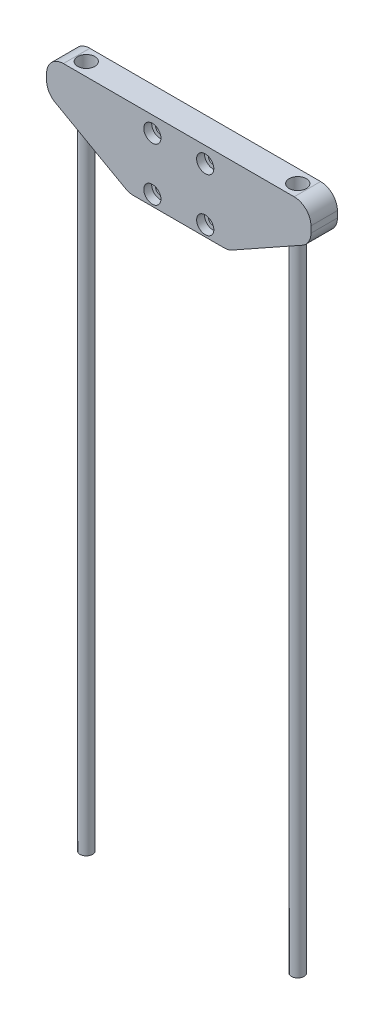
from build123d import *

# Parameters (mm, degrees)
BOSS_EXTRUDE1_DEPTH            = 5
CUT_EXTRUDE1_DEPTH             = 10
SKETCH4_W                      = 2.38125
SKETCH4_H                      = 243.6
SKETCH4_3_W                    = 2.38125
SKETCH4_3_H                    = 243.6
CBORE_FOR_M3_SHCS1_AT_2_COUNT  = 2
CBORE_FOR_M3_SHCS1_AT_2_PITCH  = 20
CBORE_FOR_M3_SHCS1_AT_3_COUNT  = 2
CBORE_FOR_M3_SHCS1_AT_3_PITCH  = 28.284271247
CBORE_FOR_M3_SHCS1_AT_4_COUNT  = 2
CBORE_FOR_M3_SHCS1_AT_4_PITCH  = 20
CBORE_FOR_M3_SHCS2_AT_2_COUNT  = 2
CBORE_FOR_M3_SHCS2_AT_2_PITCH  = 80
M3X0_5_TAPPED_HOLE1_AT_2_COUNT = 2
M3X0_5_TAPPED_HOLE1_AT_2_PITCH = 80
FILLET1_R                      = 6.35


with BuildPart() as part:
    # Sketch3 → Boss-Extrude1 (new, symmetric)
    with BuildSketch(Plane.XY):
        Polygon((-50, 15), (-50, 2.5), (-18.75, -15), (18.75, -15), (50, 2.5), (50, 15), align=None)
    extrude(amount=BOSS_EXTRUDE1_DEPTH, both=True)

    # Sketch10 → Cut-Extrude1 (cut)
    with BuildSketch(Plane(origin=(0, 0, 0), x_dir=(1, 0, 0), z_dir=(0, 1, 0))):
        with BuildLine():
            Line((40, 2.38125), (35, 2.38125))
            ThreePointArc((35, 2.38125), (32.61875, 0), (35, -2.38125))
            Line((35, -2.38125), (40, -2.38125))
            ThreePointArc((40, -2.38125), (42.38125, 0), (40, 2.38125))
        make_face()
        with BuildLine():
            Line((-40, 2.38125), (-35, 2.38125))
            ThreePointArc((-35, 2.38125), (-32.61875, 0), (-35, -2.38125))
            Line((-35, -2.38125), (-40, -2.38125))
            ThreePointArc((-40, -2.38125), (-42.38125, 0), (-40, 2.38125))
        make_face()
    extrude(amount=-CUT_EXTRUDE1_DEPTH, mode=Mode.SUBTRACT)

    # Sketch6 → CBORE for M3 SHCS1 (revolve, cut)
    with BuildSketch(Plane(origin=(-10, 9, 5), x_dir=(0, -1, 0), z_dir=(1, 0, 0))):
        Polygon((0, 0), (0, 10), (1.8, 10), (1.8, 3), (3.25, 3), (3.25, 0), align=None)
    cbore_for_m3_shcs1 = revolve(axis=Axis((-10, 9, 11.35), (0, 0, -1)), mode=Mode.SUBTRACT)

    # CBORE for M3 SHCS1 at 2: CBORE for M3 SHCS1 ×2
    with Locations(*[(0, -i * CBORE_FOR_M3_SHCS1_AT_2_PITCH, 0) for i in range(1, CBORE_FOR_M3_SHCS1_AT_2_COUNT)]):
        add(cbore_for_m3_shcs1, mode=Mode.SUBTRACT)

    # CBORE for M3 SHCS1 at 3: CBORE for M3 SHCS1 ×2
    with Locations(*[Vector(0.707106781186549, -0.707106781186546, 0) * (i * CBORE_FOR_M3_SHCS1_AT_3_PITCH) for i in range(1, CBORE_FOR_M3_SHCS1_AT_3_COUNT)]):
        add(cbore_for_m3_shcs1, mode=Mode.SUBTRACT)

    # CBORE for M3 SHCS1 at 4: CBORE for M3 SHCS1 ×2
    with Locations(*[(i * CBORE_FOR_M3_SHCS1_AT_4_PITCH, 0, 0) for i in range(1, CBORE_FOR_M3_SHCS1_AT_4_COUNT)]):
        add(cbore_for_m3_shcs1, mode=Mode.SUBTRACT)

    # Sketch12 → CBORE for M3 SHCS2 (revolve, cut)
    with BuildSketch(Plane(origin=(-40, 15, 0), x_dir=(0, 0, 1), z_dir=(1, 0, 0))):
        Polygon((0, 0), (0, 258.6), (1.8, 258.6), (1.8, 11), (3.25, 11), (3.25, 0), align=None)
    cbore_for_m3_shcs2 = revolve(axis=Axis((-40, 21.35, 0), (0, -1, 0)), mode=Mode.SUBTRACT)

    # CBORE for M3 SHCS2 at 2: CBORE for M3 SHCS2 ×2
    with Locations(*[(i * CBORE_FOR_M3_SHCS2_AT_2_PITCH, 0, 0) for i in range(1, CBORE_FOR_M3_SHCS2_AT_2_COUNT)]):
        add(cbore_for_m3_shcs2, mode=Mode.SUBTRACT)

    # Fillet1
    fillet1_edges = [part.edges().sort_by_distance(p)[0] for p in [
        (-18.75, -15, 0),
        (18.75, -15, 0),
        (50, 2.5, 0),
        (50, 15, 0),
        (-50, 15, 0),
        (-50, 2.5, 0),
    ]]
    fillet(fillet1_edges, radius=FILLET1_R)


with BuildPart() as body_2:
    # Sketch4 → Revolve1 (revolve)
    with BuildSketch(Plane.XY):
        with Locations((-41.190625, -121.8)):
            Rectangle(SKETCH4_W, SKETCH4_H)
    revolve(axis=Axis((-40, -243.6, 0), (0, -1, 0)))

    # Sketch14 → M3x0.5 Tapped Hole1 (revolve, cut)
    with BuildSketch(Plane(origin=(-40, 0, 0), x_dir=(0, 0, 1), z_dir=(1, 0, 0))):
        Polygon((0, 0), (0, 8.251075774), (1.25, 7.5), (1.25, 0), align=None)
    m3x0_5_tapped_hole1 = revolve(axis=Axis((-40, 6.35, 0), (0, -1, 0)), mode=Mode.SUBTRACT)


with BuildPart() as body_3:
    # Sketch4<3> → Revolve2 (revolve)
    with BuildSketch(Plane.XY):
        with Locations((38.809375, -121.8)):
            Rectangle(SKETCH4_3_W, SKETCH4_3_H)
    revolve(axis=Axis((40, -243.6, 0), (0, -1, 0)))

    # M3x0.5 Tapped Hole1 at 2: M3x0.5 Tapped Hole1 ×2
    with Locations(*[(i * M3X0_5_TAPPED_HOLE1_AT_2_PITCH, 0, 0) for i in range(1, M3X0_5_TAPPED_HOLE1_AT_2_COUNT)]):
        add(m3x0_5_tapped_hole1, mode=Mode.SUBTRACT)


solid = Compound([part.part, body_2.part, body_3.part])
